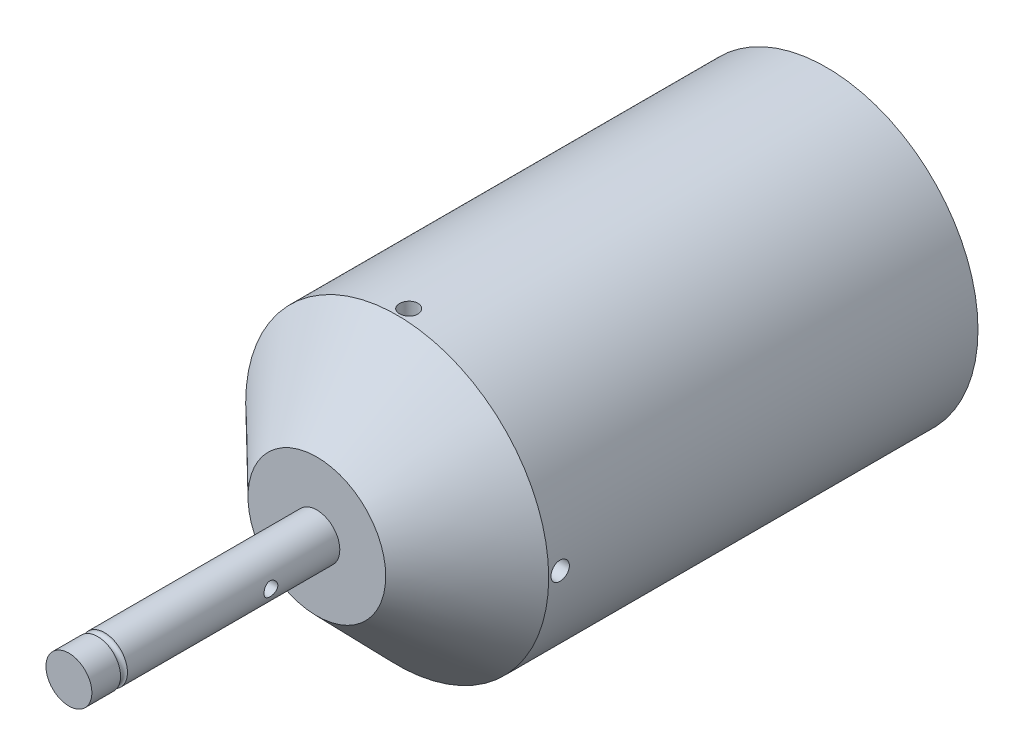
from build123d import *

# Parameters (mm, degrees)
SKETCH1_R               = 33
BOSS_EXTRUDE1_DEPTH     = 46.75
CUT_EXTRUDE1_START      = -114.313999576
SKETCH11_R              = 2
CUT_EXTRUDE1_DEPTH      = 119.313999576
CIRPATTERN1_COUNT       = 4
SKETCH12_R              = 5
BOSS_EXTRUDE5_DEPTH     = 54
CUT_EXTRUDE2_DEPTH      = 128.126167698
CUT_EXTRUDE2_DEPTH_BACK = 128.126167698
SKETCH13_R              = 1.5
SKETCH14_R              = 0.75


with BuildPart() as part:
    # Sketch1 → Boss-Extrude1 (new, symmetric)
    with BuildSketch(Plane.XY):
        Circle(SKETCH1_R)
    extrude(amount=BOSS_EXTRUDE1_DEPTH, both=True)

    # Sketch10 → Revolve1 (revolve)
    with BuildSketch(Plane(origin=(0, 0, 0), x_dir=(0, 0, -1), z_dir=(1, 0, 0))):
        Polygon((-64.25, 0), (-64.25, 15), (-46.75, 33), (-46.75, 0), align=None)
    revolve(axis=Axis((0, 0, 1000), (0, 0, -1)))

    # Sketch11 → Cut-Extrude1 (cut)
    with BuildSketch(Plane(origin=(-33, 33, 0), x_dir=(0, 0, -1), z_dir=(0, -1, 0)).offset(CUT_EXTRUDE1_START)):
        with Locations((-44.25, 33)):
            Circle(SKETCH11_R)
    cut_extrude1 = extrude(amount=CUT_EXTRUDE1_DEPTH, mode=Mode.SUBTRACT)

    # CirPattern1: Cut-Extrude1 ×4 about axis
    cirpattern1_axis = Axis((0, 0, 46.75), (0, 0, 1))
    for i in range(1, CIRPATTERN1_COUNT):
        add(cut_extrude1.rotate(cirpattern1_axis, i * 360 / CIRPATTERN1_COUNT), mode=Mode.SUBTRACT)

    # Sketch12 → Boss-Extrude5 (add)
    with BuildSketch(Plane.XY.offset(64.25)):
        Circle(SKETCH12_R)
    extrude(amount=BOSS_EXTRUDE5_DEPTH)

    # Sketch13 → Cut-Extrude2 (cut, two sides: drawn at the far end of the back side and taken through both)
    with BuildSketch(Plane(origin=(0, 0, 0), x_dir=(0, 0, -1), z_dir=(1, 0, 0)).offset(-CUT_EXTRUDE2_DEPTH_BACK)):
        with Locations((-79.25, 0)):
            Circle(SKETCH13_R)
    extrude(amount=CUT_EXTRUDE2_DEPTH + CUT_EXTRUDE2_DEPTH_BACK, mode=Mode.SUBTRACT)

    # Sketch14 → Cut-Revolve1 (revolve, cut)
    with BuildSketch(Plane(origin=(0, 0, 0), x_dir=(0, 0, -1), z_dir=(1, 0, 0))):
        with Locations((-111.25, 5)):
            Circle(SKETCH14_R)
    revolve(axis=Axis((0, 0, 118.25), (0, 0, -1)), mode=Mode.SUBTRACT)


solid = part.part
